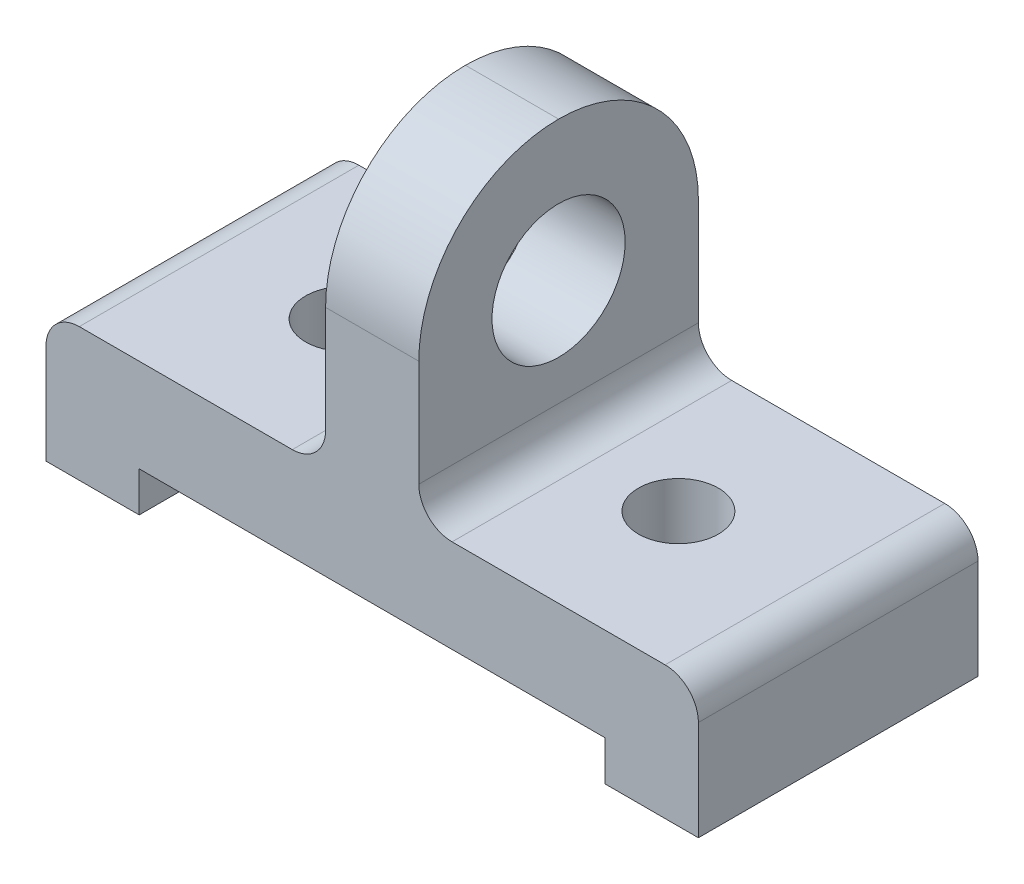
from build123d import *

# Parameters (mm, degrees)
SKETCH1_W           = 248.92
SKETCH1_H           = 106.68
BOSS_EXTRUDE1_DEPTH = 50.8
SKETCH2_W           = 177.8
SKETCH2_H           = 106.68
CUT_EXTRUDE1_DEPTH  = 15.24
SKETCH3_R           = 15.24
CUT_EXTRUDE3_DEPTH  = 35.56
SKETCH3_4_W         = 35.56
SKETCH3_4_H         = 106.68
BOSS_EXTRUDE2_DEPTH = 106.68
SKETCH4_R           = 25.4
CUT_EXTRUDE4_DEPTH  = 35.56
FILLET1_R           = 53.34
FILLET2_R           = 12.7
FILLET3_R           = 12.7


with BuildPart() as part:
    # Sketch1 → Boss-Extrude1 (new body)
    with BuildSketch(Plane(origin=(0, 0, 0), x_dir=(1, 0, 0), z_dir=(0, 1, 0))):
        with Locations((124.46, -53.34)):
            Rectangle(SKETCH1_W, SKETCH1_H)
    extrude(amount=BOSS_EXTRUDE1_DEPTH)

    # Sketch2 → Cut-Extrude1 (cut)
    with BuildSketch(Plane.XZ):
        with Locations((124.46, 53.34)):
            Rectangle(SKETCH2_W, SKETCH2_H)
    extrude(amount=-CUT_EXTRUDE1_DEPTH, mode=Mode.SUBTRACT)

    # Sketch3 → Cut-Extrude3 (cut)
    with BuildSketch(Plane(origin=(0, 50.8, 0), x_dir=(1, 0, 0), z_dir=(0, 1, 0))):
        with Locations(Location((60.96, -53.34, 0), (0, 0, 270))):
            Circle(SKETCH3_R)
        with Locations(Location((187.96, -53.34, 0), (0, 0, 270))):
            Circle(SKETCH3_R)
    extrude(amount=-CUT_EXTRUDE3_DEPTH, mode=Mode.SUBTRACT)

    # Sketch3<4> → Boss-Extrude2 (add)
    with BuildSketch(Plane(origin=(0, 50.8, 0), x_dir=(1, 0, 0), z_dir=(0, 1, 0))):
        with Locations((124.46, -53.34)):
            Rectangle(SKETCH3_4_W, SKETCH3_4_H)
    extrude(amount=BOSS_EXTRUDE2_DEPTH)

    # Sketch4 → Cut-Extrude4 (cut)
    with BuildSketch(Plane(origin=(142.24, 0, 0), x_dir=(0, 0, -1), z_dir=(1, 0, 0))):
        with Locations((-53.34, 104.14)):
            Circle(SKETCH4_R)
    extrude(amount=-CUT_EXTRUDE4_DEPTH, mode=Mode.SUBTRACT)

    # Fillet1
    fillet1_edges = [part.edges().sort_by_distance(p)[0] for p in [
        (124.46, 157.48, 106.68),
        (124.46, 157.48, 0),
    ]]
    fillet(fillet1_edges, radius=FILLET1_R - 0.0001)  # a hair under: the kernel refuses the full size

    # Fillet2
    fillet2_edges = [part.edges().sort_by_distance(p)[0] for p in [
        (248.92, 50.8, 53.34),
        (0, 50.8, 53.34),
    ]]
    fillet(fillet2_edges, radius=FILLET2_R)

    # Fillet3
    fillet3_edges = [part.edges().sort_by_distance(p)[0] for p in [
        (106.68, 50.8, 53.34),
        (142.24, 50.8, 53.34),
    ]]
    fillet(fillet3_edges, radius=FILLET3_R)


solid = part.part
